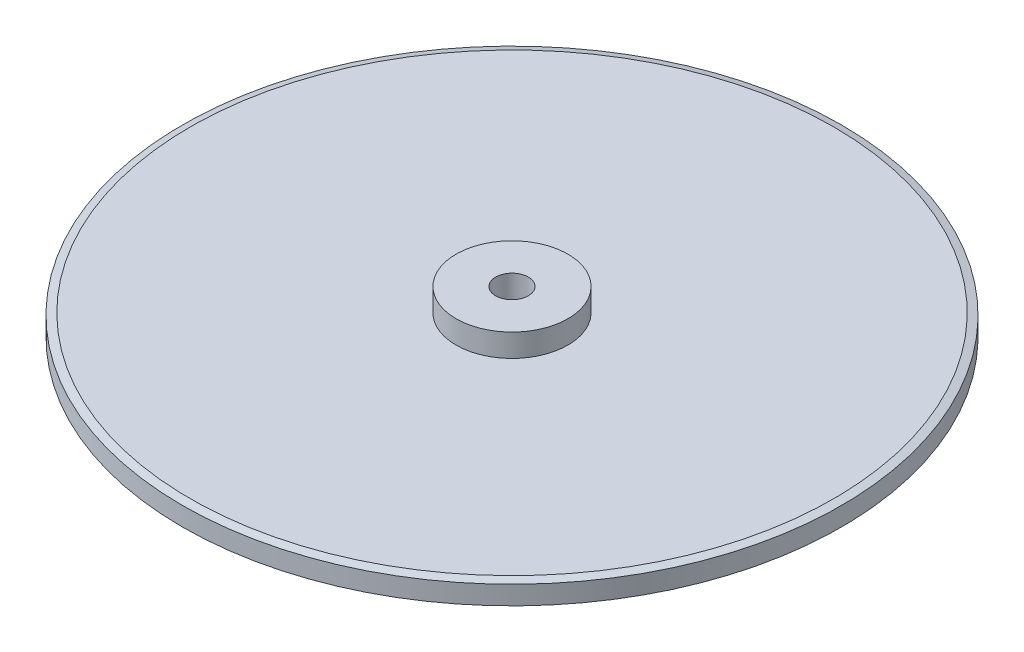
from build123d import *

# Parameters (mm, degrees)
CHAMFER_1_SIZE           = 1.645
CHAMFER_1_SIZE2          = 0.440776422
CHAMFER_2_SIZE           = 1.645
CHAMFER_2_SIZE2          = 0.440776422
CUT_EXTRUDE_3_DEPTH      = 101.464023411
CUT_EXTRUDE_3_DEPTH_BACK = 101.464023411
SKETCH_2_R               = 3.5


with BuildPart() as part:
    # Эскиз1 → Повернуть2 (revolve)
    with BuildSketch(Plane.XY):
        Polygon((0, 0), (70.7, 0), (70.7, 4.9), (12, 4.9), (12, 9.8), (0, 9.8), align=None)
    revolve(axis=Axis((0, 9.8, 0), (0, -1, 0)))

    # Фаска1
    chamfer_1_edges = [part.edges().sort_by_distance(p)[0] for p in [
        (-70.7, 4.9, 0),
    ]]
    chamfer_1_side = [part.faces().sort_by_distance(p)[0] for p in [
        (-68.700302023, 4.9, 0),
    ]]
    chamfer(chamfer_1_edges, length=CHAMFER_1_SIZE, length2=CHAMFER_1_SIZE2, reference=chamfer_1_side[0])

    # Фаска2
    chamfer_2_edges = [part.edges().sort_by_distance(p)[0] for p in [
        (-70.7, 0, 0),
    ]]
    chamfer_2_side = [part.faces().sort_by_distance(p)[0] for p in [
        (0, 0, 0),
    ]]
    chamfer(chamfer_2_edges, length=CHAMFER_2_SIZE, length2=CHAMFER_2_SIZE2, reference=chamfer_2_side[0])

    # Эскиз2 → Вырез-Вытянуть3 (cut, two sides: drawn at the far end of the back side and taken through both)
    with BuildSketch(Plane(origin=(0, 0, 0), x_dir=(-1, 0, 0), z_dir=(0, -1, 0)).offset(-CUT_EXTRUDE_3_DEPTH_BACK)):
        Circle(SKETCH_2_R)
    extrude(amount=CUT_EXTRUDE_3_DEPTH + CUT_EXTRUDE_3_DEPTH_BACK, mode=Mode.SUBTRACT)


solid = part.part
